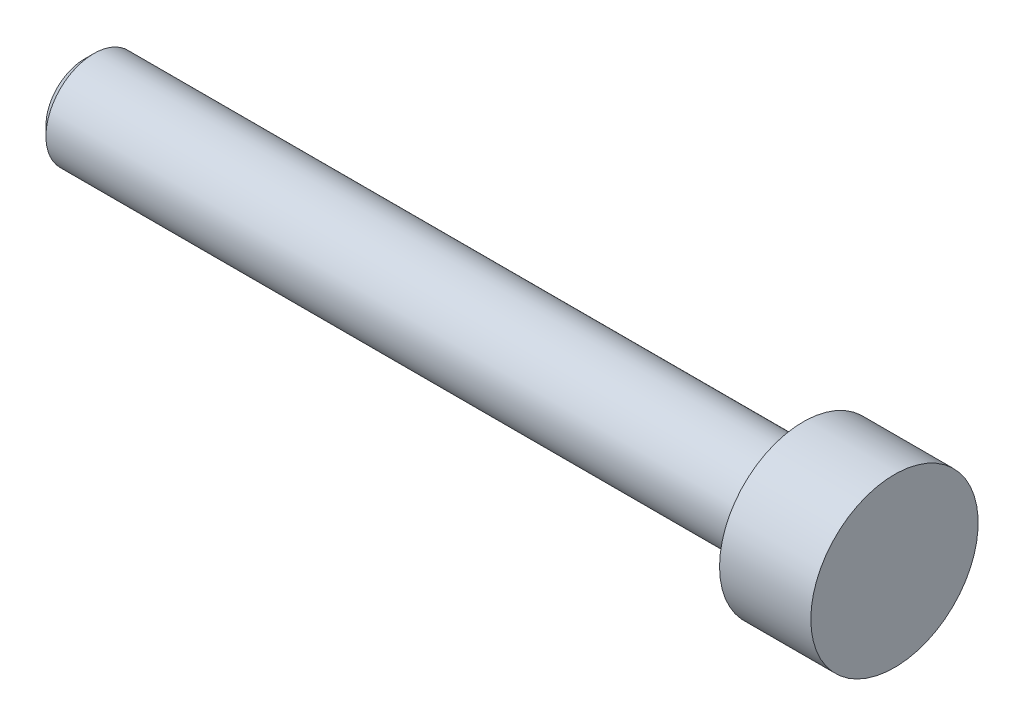
from build123d import *


# Read off the part's stored shape, not the designer's step: M4x0.7 Machine Threads Stud1
with BuildPart() as part:
    # Sketch1 → Revolve1 (revolve)
    with BuildSketch(Plane(origin=(0, 0, 0), x_dir=(-1, 0, 0), z_dir=(0, 1, 0))):
        Polygon((0, 2.0066), (0, 0), (-33.809999944, 0), (-33.809999944, 3.4925), (-29.999999944, 3.4925), (-29.999999944, 2.0066), align=None)
    revolve(axis=Axis((0, 0, 0), (1, 0, 0)))

    # M4x0.7 Machine Threads Stud1 outline → M4x0.7 Machine Threads Stud1 (revolve, cut)
    with BuildSketch(Plane.YX):
        Polygon((1.61, 0), (2.0066, 0), (2.0066, 29.999999944), (2, 29.999999944), (2, 0.39), align=None)
    revolve(axis=Axis((0, 0, 0), (1, 0, 0)), mode=Mode.SUBTRACT)


solid = part.part
